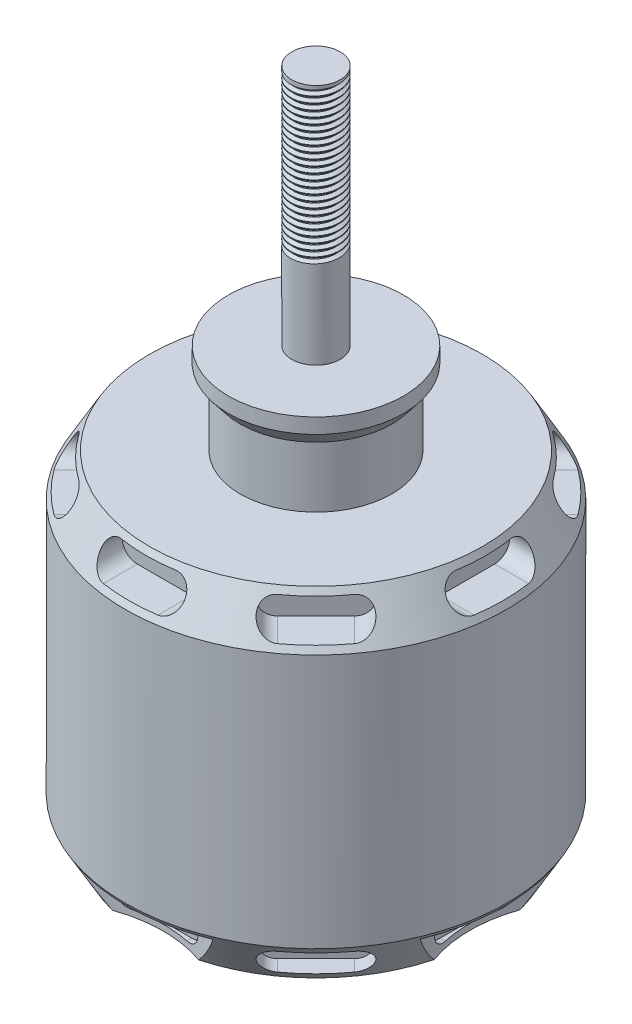
from build123d import *

# Parameters (mm, degrees)
SKETCH1_R                = 31.5
BOSS_EXTRUDE1_DEPTH      = 40.7
SKETCH3_R                = 27.5
SKETCH5_R                = 12.5
BOSS_EXTRUDE2_DEPTH      = 10
SKETCH8_R                = 14.462027676
BOSS_EXTRUDE3_DEPTH      = 2.5
SKETCH9_R                = 4
BOSS_EXTRUDE4_DEPTH      = 40
THREAD1_PITCH            = 1
SKETCH17_R               = 31.5
BOSS_EXTRUDE5_DEPTH      = 1.3
SKETCH18_R               = 27.5
SKETCH20_R               = 6.5
BOSS_EXTRUDE6_DEPTH      = 0.75
SKETCH21_R               = 7
BOSS_EXTRUDE7_DEPTH      = 5.55
SKETCH23_R               = 2
CUT_EXTRUDE3_DEPTH       = 4
CIRPATTERN3_COUNT        = 4
CUT_EXTRUDE4_DEPTH       = 6.4
CIRPATTERN4_COUNT        = 4
CUT_EXTRUDE6_DEPTH       = 10
LPATTERN1_COUNT          = 2
LPATTERN1_PITCH          = 49
CIRPATTERN6_COUNT        = 8
CIRPATTERN6_COPY_1_DEPTH = 10
CIRPATTERN6_COPY_2_DEPTH = 10
CIRPATTERN6_COPY_3_DEPTH = 10
CIRPATTERN6_COPY_4_DEPTH = 10
CIRPATTERN6_COPY_5_DEPTH = 10
CIRPATTERN6_COPY_6_DEPTH = 10
CIRPATTERN6_COPY_7_DEPTH = 10


with BuildPart() as part:
    # Sketch1 → Boss-Extrude1 (new body)
    with BuildSketch(Plane(origin=(0, 0, 0), x_dir=(1, 0, 0), z_dir=(0, 1, 0))):
        with Locations(Location((0, 0, 0), (0, 0, 270))):
            Circle(SKETCH1_R)
    extrude(amount=BOSS_EXTRUDE1_DEPTH)

    # Sketch3 → section 0 of loft1
    with BuildSketch(Plane(origin=(0, 47.7, 0), x_dir=(1, 0, 0), z_dir=(0, 1, 0)), mode=Mode.PRIVATE) as loft1_s0:
        Circle(SKETCH3_R)
    # loft up to a face of the part (loft1)
    loft([loft1_s0.sketch, Face(Wire([part.edges().sort_by_distance((22.962511764, 40.7, -21.563233837))[0]]))])

    # Sketch5 → Boss-Extrude2 (add)
    with BuildSketch(Plane(origin=(0, 47.7, 0), x_dir=(1, 0, 0), z_dir=(0, 1, 0))):
        with Locations(Location((0, 0, 0), (0, 0, 270))):
            Circle(SKETCH5_R)
    extrude(amount=BOSS_EXTRUDE2_DEPTH)


with BuildPart() as body_2:
    # Sketch8 → Boss-Extrude3 (new body)
    with BuildSketch(Plane(origin=(0, 62.7, 0), x_dir=(1, 0, 0), z_dir=(0, 1, 0))):
        with Locations(Location((0, 0, 0), (0, 0, 270))):
            Circle(SKETCH8_R)
    extrude(amount=-BOSS_EXTRUDE3_DEPTH)


    add(part.part)  # loft3 joins it to this body
    # loft up to a face of the part (loft3)
    loft([Face(Wire([body_2.edges().sort_by_distance((-10.542364464, 60.2, -9.899939191))[0]])), Face(Wire([body_2.edges().sort_by_distance((9.112107843, 57.7, -8.556838824))[0]]))])

    # Sketch9 → Boss-Extrude4 (add)
    with BuildSketch(Plane(origin=(0, 62.7, 0), x_dir=(1, 0, 0), z_dir=(0, 1, 0))):
        with Locations(Location((0, 0, 0), (0, 0, 270))):
            Circle(SKETCH9_R)
    extrude(amount=BOSS_EXTRUDE4_DEPTH)

    # Thread1: the profile of Thread Profile1 profile screwed along a right-hand helix of 25 turns, 8 arcs to a turn; built about Z, then put on its axis
    thread1_z = Axis((0, 0, 0), (0, 0, 1))
    thread1_corners = [(4.0003, 0, -0.000173205), (4.0003, 0, 0.875173202), (3.458734125, 0, 0.562499999), (3.458734125, 0, 0.312499999)]
    with BuildLine(mode=Mode.PRIVATE) as thread1_profile:
        Line(thread1_corners[0], thread1_corners[1])
        Line(thread1_corners[1], thread1_corners[2])
        Line(thread1_corners[2], thread1_corners[3])
        Line(thread1_corners[3], thread1_corners[0])
    thread1_cap = Face(thread1_profile.wire())
    thread1_turn_angles = [0, 22.5, 45, 67.5, 90, 112.5, 135, 157.5, 180, 202.5, 225, 247.5, 270, 292.5, 315, 337.5, 360]
    thread1_turn_weights = [1, 0.9238795325112867, 1, 0.9238795325112867, 1, 0.9238795325112867, 1, 0.9238795325112867, 1, 0.9238795325112867, 1, 0.9238795325112867, 1, 0.9238795325112867, 1, 0.9238795325112867, 1]
    thread1_turn_rails = [Edge.make_bspline([Vector(p[0], p[1], 0).rotate(thread1_z, thread1_turn_angles[k]) / thread1_turn_weights[k] + Vector(0, 0, p[2] + THREAD1_PITCH * thread1_turn_angles[k] / 360) for k in range(17)], [0, 0, 0, 1, 1, 2, 2, 3, 3, 4, 4, 5, 5, 6, 6, 7, 7, 8, 8, 8], 2, thread1_turn_weights) for p in thread1_corners]
    thread1_turn_sides = [Face.make_surface_from_curves(thread1_turn_rails[p[0]], thread1_turn_rails[p[1]]) for p in [(0, 1), (1, 2), (2, 3), (3, 0)]]
    thread1 = Plane(origin=(0, 102.7, 0), x_dir=(-1, 0, 0), z_dir=(0, -1, 0)) * Solid(Shell([*[p.moved(Location((0, 0, THREAD1_PITCH * i))) for i in range(25) for p in thread1_turn_sides], thread1_cap, thread1_cap.rotate(thread1_z, 9000).moved(Location((0, 0, THREAD1_PITCH * 9000 / 360)))]))
    add(thread1, mode=Mode.SUBTRACT)

    # Sketch17 → Boss-Extrude5 (add)
    with BuildSketch(Plane.XZ):
        with Locations(Location((0, 0, 0), (0, 0, 270))):
            Circle(SKETCH17_R)
    extrude(amount=BOSS_EXTRUDE5_DEPTH)

    # Sketch18 → section 0 of loft4
    with BuildSketch(Plane(origin=(0, -8.3, 0), x_dir=(-1, 0, 0), z_dir=(0, -1, 0)), mode=Mode.PRIVATE) as loft4_s0:
        Circle(SKETCH18_R)
    # loft up to a face of the part (loft4)
    loft([loft4_s0.sketch, Face(Wire([body_2.edges().sort_by_distance((22.962511764, -1.3, 21.563233837))[0]]))])

    # Sketch20 → Boss-Extrude6 (add)
    with BuildSketch(Plane.XZ.offset(8.3)):
        with Locations(Location((0, 0, 0), (0, 0, 270))):
            Circle(SKETCH20_R)
    extrude(amount=BOSS_EXTRUDE6_DEPTH)

    # Sketch21 → Boss-Extrude7 (add)
    with BuildSketch(Plane.XZ.offset(9.05)):
        with Locations(Location((0, 0, 0), (0, 0, 270))):
            Circle(SKETCH21_R)
    extrude(amount=BOSS_EXTRUDE7_DEPTH)

    # Sketch23 → Cut-Extrude3 (cut)
    with BuildSketch(Plane.XZ.offset(8.3)):
        with Locations(Location((0, 22, 0), (0, 0, 270))):
            Circle(SKETCH23_R)
        with Locations(Location((0, 15, 0), (0, 0, 270))):
            Circle(SKETCH23_R)
    cut_extrude3 = extrude(amount=-CUT_EXTRUDE3_DEPTH, mode=Mode.SUBTRACT)

    # CirPattern3: Cut-Extrude3 ×4 about axis
    cirpattern3_axis = Axis((0, 0, 0), (0, 1, 0))
    for i in range(1, CIRPATTERN3_COUNT):
        add(cut_extrude3.rotate(cirpattern3_axis, i * 360 / CIRPATTERN3_COUNT), mode=Mode.SUBTRACT)

    # Sketch26 → Cut-Extrude4 (cut)
    with BuildSketch(Plane.XZ.offset(8.3)):
        with BuildLine():
            Line((-12.036404536, 29.109705698), (-11.605104015, 34.540054152))
            Line((-11.605104015, 34.540054152), (12.956074773, 30.527699166))
            Line((12.956074773, 30.527699166), (11.970258154, 28.924784262))
            ThreePointArc((11.970258154, 28.924784262), (-0.061369349, 25.343812896), (-12.036404536, 29.109705698))
        make_face()
    cut_extrude4 = extrude(amount=-CUT_EXTRUDE4_DEPTH, mode=Mode.SUBTRACT)

    # CirPattern4: Cut-Extrude4 ×4 about axis
    cirpattern4_axis = Axis((0, 0, 0), (0, 1, 0))
    for i in range(1, CIRPATTERN4_COUNT):
        add(cut_extrude4.rotate(cirpattern4_axis, i * 360 / CIRPATTERN4_COUNT), mode=Mode.SUBTRACT)

    # Sketch32 → Cut-Extrude6 (cut)
    with BuildSketch(Plane(origin=(24.748737342, 0, 24.748737342), x_dir=(0, -1, 0), z_dir=(0.7071067811865464, 0, 0.7071067811865488))):
        with BuildLine():
            Line((-46.7, -4.5), (-46.7, 4.5))
            ThreePointArc((-46.7, 4.5), (-44.2, 7), (-41.7, 4.5))
            Line((-41.7, 4.5), (-41.7, -4.5))
            ThreePointArc((-41.7, -4.5), (-44.2, -7), (-46.7, -4.5))
        make_face()
    cut_extrude6 = extrude(amount=-CUT_EXTRUDE6_DEPTH, mode=Mode.SUBTRACT)

    # LPattern1: Cut-Extrude6 ×2
    with Locations(*[(0, -i * LPATTERN1_PITCH, 0) for i in range(1, LPATTERN1_COUNT)]):
        add(cut_extrude6, mode=Mode.SUBTRACT)

    # CirPattern6: Cut-Extrude6 ×8 about axis
    cirpattern6_axis = Axis((0, 0, 0), (0, 1, 0))
    for i in range(1, CIRPATTERN6_COUNT):
        add(cut_extrude6.rotate(cirpattern6_axis, i * 360 / CIRPATTERN6_COUNT), mode=Mode.SUBTRACT)

    # CirPattern6 copy 1 sketch → CirPattern6 copy 1 (cut)
    with BuildSketch(Plane(origin=(35, -49, 0), x_dir=(0, -1, 0), z_dir=(1, 0, 0))):
        with BuildLine():
            Line((-46.7, -4.5), (-46.7, 4.5))
            ThreePointArc((-46.7, 4.5), (-44.2, 7), (-41.7, 4.5))
            Line((-41.7, 4.5), (-41.7, -4.5))
            ThreePointArc((-41.7, -4.5), (-44.2, -7), (-46.7, -4.5))
        make_face()
    extrude(amount=-CIRPATTERN6_COPY_1_DEPTH, mode=Mode.SUBTRACT)

    # CirPattern6 copy 2 sketch → CirPattern6 copy 2 (cut)
    with BuildSketch(Plane(origin=(24.748737342, -49, -24.748737342), x_dir=(0, -1, 0), z_dir=(0.7071067811865488, 0, -0.7071067811865464))):
        with BuildLine():
            Line((-46.7, -4.5), (-46.7, 4.5))
            ThreePointArc((-46.7, 4.5), (-44.2, 7), (-41.7, 4.5))
            Line((-41.7, 4.5), (-41.7, -4.5))
            ThreePointArc((-41.7, -4.5), (-44.2, -7), (-46.7, -4.5))
        make_face()
    extrude(amount=-CIRPATTERN6_COPY_2_DEPTH, mode=Mode.SUBTRACT)

    # CirPattern6 copy 3 sketch → CirPattern6 copy 3 (cut)
    with BuildSketch(Plane(origin=(0, -49, -35), x_dir=(0, -1, 0), z_dir=(0, 0, -1))):
        with BuildLine():
            Line((-46.7, -4.5), (-46.7, 4.5))
            ThreePointArc((-46.7, 4.5), (-44.2, 7), (-41.7, 4.5))
            Line((-41.7, 4.5), (-41.7, -4.5))
            ThreePointArc((-41.7, -4.5), (-44.2, -7), (-46.7, -4.5))
        make_face()
    extrude(amount=-CIRPATTERN6_COPY_3_DEPTH, mode=Mode.SUBTRACT)

    # CirPattern6 copy 4 sketch → CirPattern6 copy 4 (cut)
    with BuildSketch(Plane(origin=(-24.748737342, -49, -24.748737342), x_dir=(0, -1, 0), z_dir=(-0.7071067811865462, 0, -0.7071067811865489))):
        with BuildLine():
            Line((-46.7, -4.5), (-46.7, 4.5))
            ThreePointArc((-46.7, 4.5), (-44.2, 7), (-41.7, 4.5))
            Line((-41.7, 4.5), (-41.7, -4.5))
            ThreePointArc((-41.7, -4.5), (-44.2, -7), (-46.7, -4.5))
        make_face()
    extrude(amount=-CIRPATTERN6_COPY_4_DEPTH, mode=Mode.SUBTRACT)

    # CirPattern6 copy 5 sketch → CirPattern6 copy 5 (cut)
    with BuildSketch(Plane(origin=(-35, -49, 0), x_dir=(0, -1, 0), z_dir=(-1, 0, 0))):
        with BuildLine():
            Line((-46.7, -4.5), (-46.7, 4.5))
            ThreePointArc((-46.7, 4.5), (-44.2, 7), (-41.7, 4.5))
            Line((-41.7, 4.5), (-41.7, -4.5))
            ThreePointArc((-41.7, -4.5), (-44.2, -7), (-46.7, -4.5))
        make_face()
    extrude(amount=-CIRPATTERN6_COPY_5_DEPTH, mode=Mode.SUBTRACT)

    # CirPattern6 copy 6 sketch → CirPattern6 copy 6 (cut)
    with BuildSketch(Plane(origin=(-24.748737342, -49, 24.748737342), x_dir=(0, -1, 0), z_dir=(-0.7071067811865489, 0, 0.7071067811865462))):
        with BuildLine():
            Line((-46.7, -4.5), (-46.7, 4.5))
            ThreePointArc((-46.7, 4.5), (-44.2, 7), (-41.7, 4.5))
            Line((-41.7, 4.5), (-41.7, -4.5))
            ThreePointArc((-41.7, -4.5), (-44.2, -7), (-46.7, -4.5))
        make_face()
    extrude(amount=-CIRPATTERN6_COPY_6_DEPTH, mode=Mode.SUBTRACT)

    # CirPattern6 copy 7 sketch → CirPattern6 copy 7 (cut)
    with BuildSketch(Plane(origin=(0, -49, 35), x_dir=(0, -1, 0), z_dir=(0, 0, 1))):
        with BuildLine():
            Line((-46.7, -4.5), (-46.7, 4.5))
            ThreePointArc((-46.7, 4.5), (-44.2, 7), (-41.7, 4.5))
            Line((-41.7, 4.5), (-41.7, -4.5))
            ThreePointArc((-41.7, -4.5), (-44.2, -7), (-46.7, -4.5))
        make_face()
    extrude(amount=-CIRPATTERN6_COPY_7_DEPTH, mode=Mode.SUBTRACT)


solid = body_2.part
